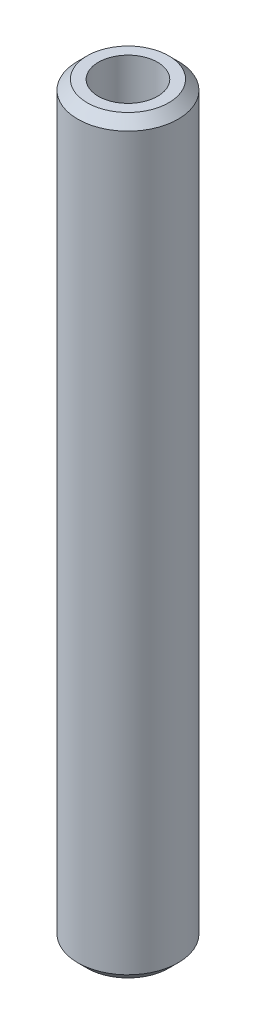
from build123d import *

# Parameters (mm, degrees)
SKETCH1_R           = 12.5
BOSS_EXTRUDE1_DEPTH = 186.592302549
SKETCH2_R           = 7.364369504
CUT_EXTRUDE1_DEPTH  = 188.427819094
CHAMFER1_SIZE       = 2.357298204


with BuildPart() as part:
    # Sketch1 → Boss-Extrude1 (new body)
    with BuildSketch(Plane(origin=(0, 0, 0), x_dir=(1, 0, 0), z_dir=(0, 1, 0))):
        Circle(SKETCH1_R)
    extrude(amount=BOSS_EXTRUDE1_DEPTH)

    # Sketch2 → Cut-Extrude1 (cut, through all)
    with BuildSketch(Plane(origin=(0, 0, 0), x_dir=(1, 0, 0), z_dir=(0, 1, 0))):
        Circle(SKETCH2_R)
    extrude(amount=CUT_EXTRUDE1_DEPTH, mode=Mode.SUBTRACT)

    # Chamfer1
    chamfer1_edges = [part.edges().sort_by_distance(p)[0] for p in [
        (-12.5, 186.592302549, 0),
        (-12.5, 0, 0),
    ]]
    chamfer(chamfer1_edges, length=CHAMFER1_SIZE)


solid = part.part
